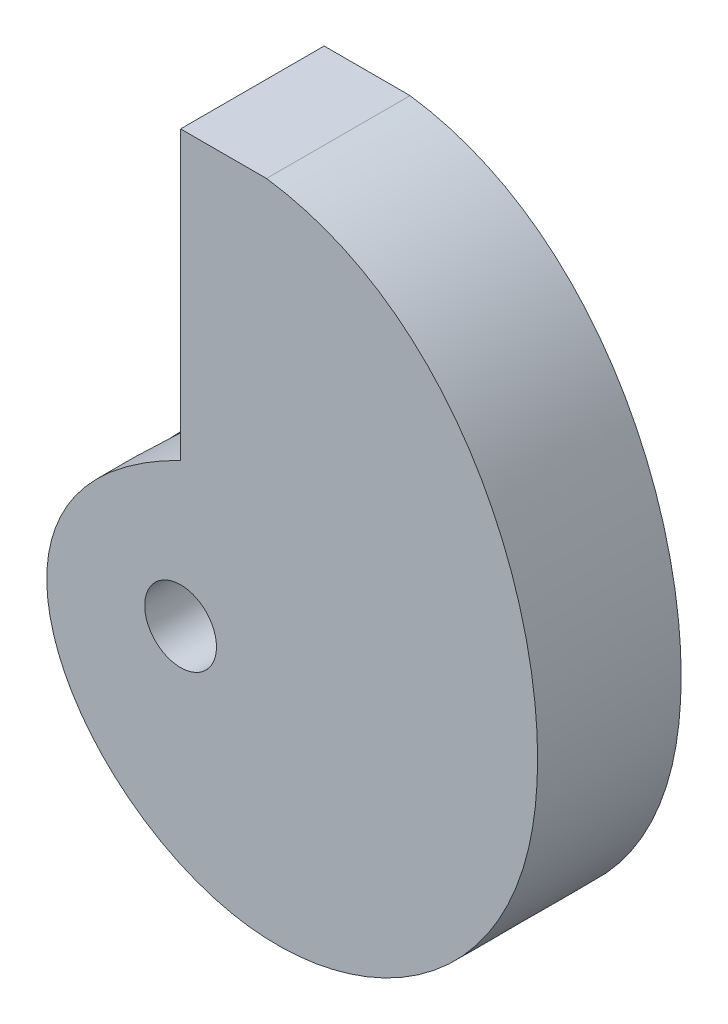
from build123d import *

# Parameters (mm, degrees)
BOSS_EXTRUDE1_DEPTH = 12.7


with BuildPart() as part:
    # Sketch1 → Boss-Extrude1 (new body)
    with BuildSketch(Plane.XY):
        with BuildLine():
            Line((0, 38.1), (0, 12.7))
            add(Edge.make_bspline(
                [(7.599767601, 38.1), (26.246073074, 35.529347142), (41.164337366, -6.756573634), (-0.46828552, -31.547387173), (-21.773032453, 1.949257827), (0, 12.7)],
                knots=[0.037945328, 0.037945328, 0.037945328, 0.037945328, 0.338030766, 0.620420862, 1, 1, 1, 1], degree=3))
            Line((7.599767601, 38.1), (0, 38.1))
        make_face()
        with BuildLine():
            ThreePointArc((3.175, 0), (-2.24506403, -2.24506403), (0, 3.175))
            ThreePointArc((0, 3.175), (2.24506403, 2.24506403), (3.175, 0))
        make_face(mode=Mode.SUBTRACT)
    extrude(amount=BOSS_EXTRUDE1_DEPTH)


solid = part.part
